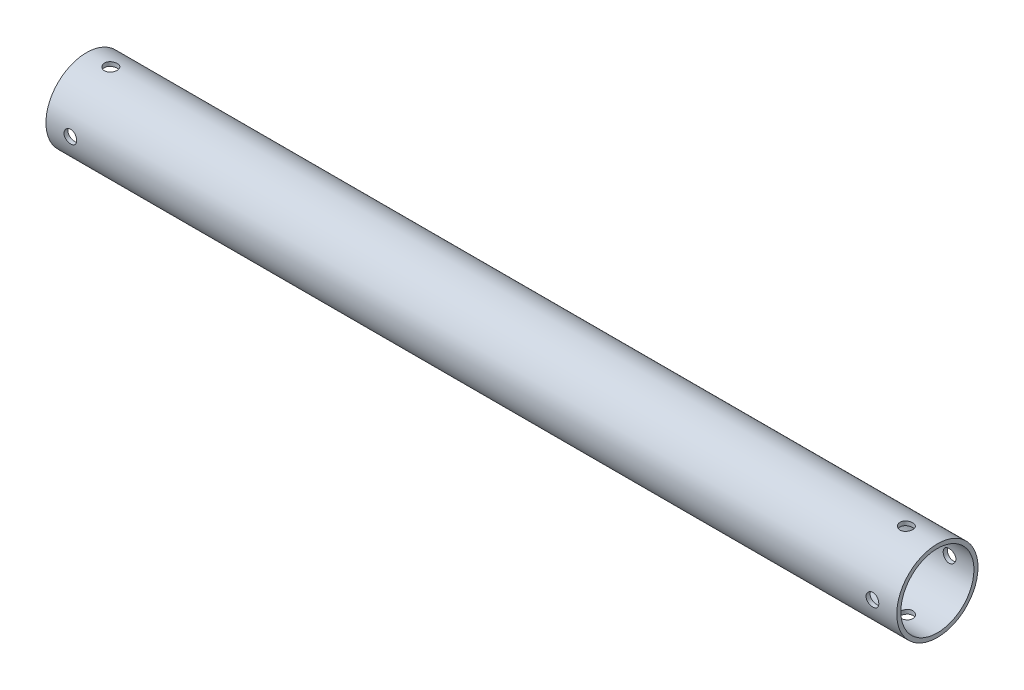
from build123d import *

# Parameters (mm, degrees)
SKETCH1_R               = 15.875
SKETCH1_R_2             = 14.2875
EXTRUDE_THIN1_DEPTH     = 166.290625
CUT_EXTRUDE1_DEPTH      = 168.799294435
CUT_EXTRUDE1_DEPTH_BACK = 168.799294435
SKETCH3_R               = 2.4892
CUT_EXTRUDE2_DEPTH      = 168.799294553
CUT_EXTRUDE2_DEPTH_BACK = 168.799294553
SKETCH4_R               = 2.4892


with BuildPart() as part:
    # Sketch1 → Extrude-Thin1 (new, symmetric)
    with BuildSketch(Plane(origin=(0, 0, 0), x_dir=(0, 0, -1), z_dir=(1, 0, 0))):
        Circle(SKETCH1_R)
        Circle(SKETCH1_R_2, mode=Mode.SUBTRACT)
    extrude(amount=EXTRUDE_THIN1_DEPTH, both=True)

    # Sketch3 → Cut-Extrude1 (cut, two sides: drawn at the far end of the back side and taken through both)
    with BuildSketch(Plane.XY.offset(-CUT_EXTRUDE1_DEPTH_BACK)):
        with Locations((-156.765625, 0)):
            Circle(SKETCH3_R)
        with Locations((156.765625, 0)):
            Circle(SKETCH3_R)
    extrude(amount=CUT_EXTRUDE1_DEPTH + CUT_EXTRUDE1_DEPTH_BACK, mode=Mode.SUBTRACT)

    # Sketch4 → Cut-Extrude2 (cut, two sides: drawn at the far end of the back side and taken through both)
    with BuildSketch(Plane(origin=(0, 0, 0), x_dir=(1, 0, 0), z_dir=(0, 1, 0)).offset(-CUT_EXTRUDE2_DEPTH_BACK)):
        with Locations((154.188327469, 0)):
            Circle(SKETCH4_R)
        with Locations((-156.765625, 0)):
            Circle(SKETCH4_R)
    extrude(amount=CUT_EXTRUDE2_DEPTH + CUT_EXTRUDE2_DEPTH_BACK, mode=Mode.SUBTRACT)


solid = part.part
